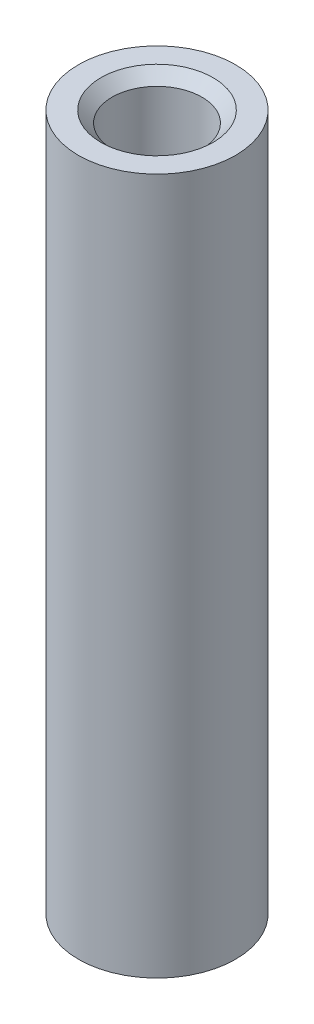
from build123d import *

# Parameters (mm, degrees)
SKETCH1_R           = 35
SKETCH1_R_2         = 20
BOSS_EXTRUDE1_DEPTH = 310.2
CHAMFER2_SIZE       = 5


with BuildPart() as part:
    # Sketch1 → Boss-Extrude1 (new body)
    with BuildSketch(Plane(origin=(0, 0, 0), x_dir=(1, 0, 0), z_dir=(0, 1, 0))):
        Circle(SKETCH1_R)
        Circle(SKETCH1_R_2, mode=Mode.SUBTRACT)
    extrude(amount=BOSS_EXTRUDE1_DEPTH)

    # Chamfer2
    chamfer2_edges = [part.edges().sort_by_distance(p)[0] for p in [
        (-20, 310.2, 0),
    ]]
    chamfer(chamfer2_edges, length=CHAMFER2_SIZE)


solid = part.part
